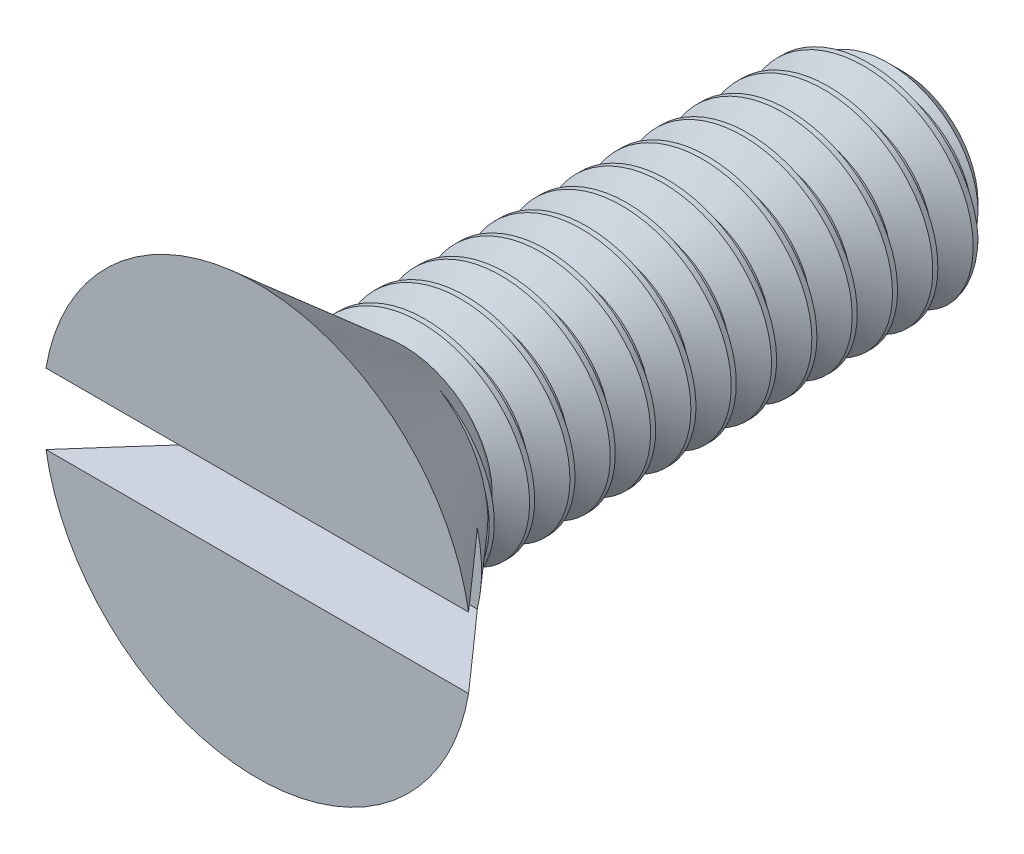
from build123d import *

# Parameters (mm, degrees)
CHAMFER1_SIZE           = 0.5953125
CUT_EXTRUDE1_DEPTH      = 9.710829921
CUT_EXTRUDE1_DEPTH_BACK = 9.710829921
SKETCH36_W              = 1.524
SKETCH36_H              = 1.388533334
CUT_SWEEP1_PITCH        = 0.79375
CUT_SWEEP1_TO           = 10.245574


with BuildPart() as part:
    # Sketch4 → Revolve1 (revolve)
    with BuildSketch(Plane(origin=(0, 0, 0), x_dir=(0, 0, -1), z_dir=(1, 0, 0)), mode=Mode.PRIVATE) as revolve1_sk:
        Polygon((-6.35, 4.2164), (-3.895573966, 2.0828), (6.35, 2.0828), (6.35, 0), (-6.35, 0), align=None)
    revolve(revolve1_sk.sketch.rotate(Axis((0, 0, -6.35), (0, 0, 1)), 90), axis=Axis((0, 0, -6.35), (0, 0, 1)))

    # Chamfer1
    chamfer1_edges = [part.edges().sort_by_distance(p)[0] for p in [
        (2.0828, 0, -6.35),
    ]]
    chamfer(chamfer1_edges, length=CHAMFER1_SIZE)


with BuildPart() as body_2:
    # Split1: the piece on the far side of the plane
    add(part.part)
    split(bisect_by=Plane.XY.offset(3.895573966), keep=Keep.BOTTOM)

    # Cut-Sweep1: arcs per turn and ends read off the stored shape
    # Cut-Sweep1: the profile of Sketch33 screwed along a right-hand helix through 18 turns, 8 arcs to a turn; built about Z, then put on its axis
    cut_sweep1_z = Axis((0, 0, 0), (0, 0, 1))
    cut_sweep1_corners = [(2.125762979, 0, 0.024804687), (2.125762979, 0, -0.719335938), (1.567244252, 0, -0.396875), (1.567244252, 0, -0.29765625)]
    with BuildLine(mode=Mode.PRIVATE) as cut_sweep1_profile:
        Line(cut_sweep1_corners[0], cut_sweep1_corners[1])
        Line(cut_sweep1_corners[1], cut_sweep1_corners[2])
        Line(cut_sweep1_corners[2], cut_sweep1_corners[3])
        Line(cut_sweep1_corners[3], cut_sweep1_corners[0])
    cut_sweep1_cap = Face(cut_sweep1_profile.wire())
    cut_sweep1_turn_angles = [0, 22.5, 45, 67.5, 90, 112.5, 135, 157.5, 180, 202.5, 225, 247.5, 270, 292.5, 315, 337.5, 360]
    cut_sweep1_turn_weights = [1, 0.9238795325112867, 1, 0.9238795325112867, 1, 0.9238795325112867, 1, 0.9238795325112867, 1, 0.9238795325112867, 1, 0.9238795325112867, 1, 0.9238795325112867, 1, 0.9238795325112867, 1]
    cut_sweep1_turn_rails = [Edge.make_bspline([Vector(p[0], p[1], 0).rotate(cut_sweep1_z, cut_sweep1_turn_angles[k]) / cut_sweep1_turn_weights[k] + Vector(0, 0, p[2] + CUT_SWEEP1_PITCH * cut_sweep1_turn_angles[k] / 360) for k in range(17)], [0, 0, 0, 1, 1, 2, 2, 3, 3, 4, 4, 5, 5, 6, 6, 7, 7, 8, 8, 8], 2, cut_sweep1_turn_weights) for p in cut_sweep1_corners]
    cut_sweep1_turn_sides = [Face.make_surface_from_curves(cut_sweep1_turn_rails[p[0]], cut_sweep1_turn_rails[p[1]]) for p in [(0, 1), (1, 2), (2, 3), (3, 0)]]
    cut_sweep1 = Plane(origin=(0, 0, -6.35), x_dir=(0, 1, 0), z_dir=(0, 0, 1)) * split(Solid(Shell([*[p.moved(Location((0, 0, CUT_SWEEP1_PITCH * i))) for i in range(18) for p in cut_sweep1_turn_sides], cut_sweep1_cap, cut_sweep1_cap.rotate(cut_sweep1_z, 6480).moved(Location((0, 0, CUT_SWEEP1_PITCH * 6480 / 360)))])), bisect_by=Plane.XY.offset(CUT_SWEEP1_TO), keep=Keep.BOTTOM, mode=Mode.PRIVATE)
    add(cut_sweep1, mode=Mode.SUBTRACT)


with BuildPart() as part_1:
    add(part.part)

    # Split1
    split(bisect_by=Plane.XY.offset(3.895573966), keep=Keep.TOP)

    # Sketch36 → Cut-Extrude1 (cut, two sides: drawn at the far end of the back side and taken through both)
    with BuildSketch(Plane(origin=(0, 0, 0), x_dir=(0, 0, -1), z_dir=(1, 0, 0)).offset(-CUT_EXTRUDE1_DEPTH_BACK)):
        with Locations((-5.588, 0)):
            Rectangle(SKETCH36_W, SKETCH36_H)
    extrude(amount=CUT_EXTRUDE1_DEPTH + CUT_EXTRUDE1_DEPTH_BACK, mode=Mode.SUBTRACT)

    add(body_2.part)  # Revolve2 merges body 2
    # Sketch35 → Revolve2 (revolve)
    with BuildSketch(Plane(origin=(0, 0, 0), x_dir=(0, 0, -1), z_dir=(1, 0, 0)), mode=Mode.PRIVATE) as revolve2_sk:
        with BuildLine():
            Line((-4.826, 2.891607012), (-3.421470914, 1.670668504))
            ThreePointArc((-3.421470914, 1.670668504), (-3.292511625, 1.59394579), (-3.144850185, 1.567244252))
            Line((-3.144850185, 1.567244252), (-2.311730185, 1.567244252))
            Line((-2.311730185, 1.567244252), (-2.311730185, 0))
            Line((-2.311730185, 0), (-4.826, 0))
            Line((-4.826, 0), (-4.826, 2.891607012))
        make_face()
    revolve(revolve2_sk.sketch.rotate(Axis((0, 0, 2.311730185), (0, 0, 1)), 270), axis=Axis((0, 0, 2.311730185), (0, 0, 1)))


solid = part_1.part
